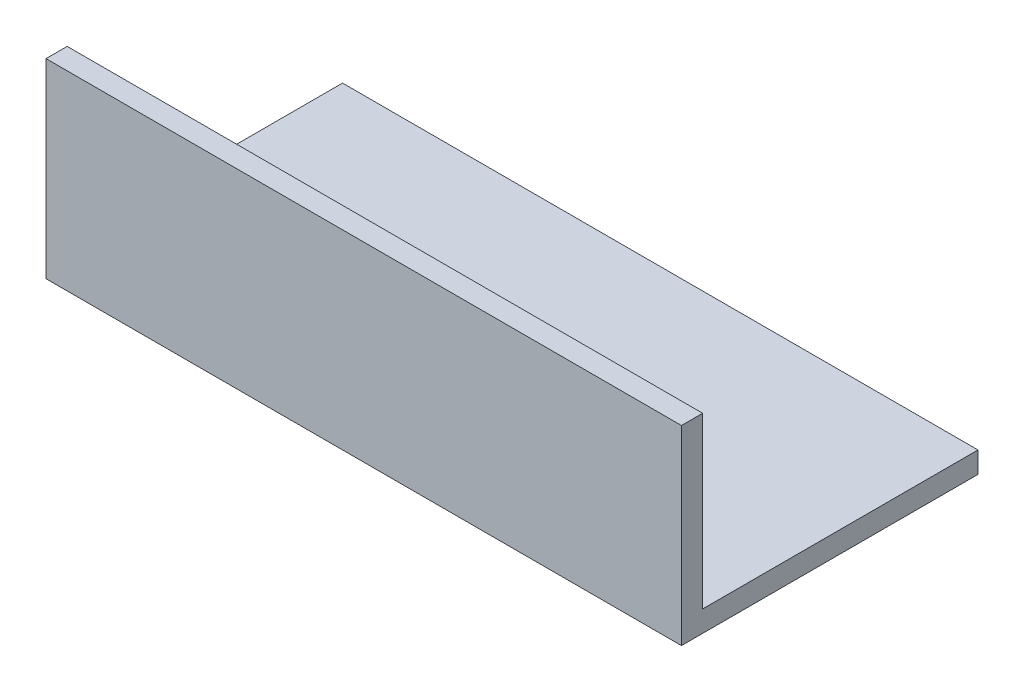
from build123d import *

# Parameters (mm, degrees)
SKETCH_1_W      = 150
SKETCH_1_H      = 40
EXTRUDE_1_DEPTH = 5
SKETCH_3_W      = 150
SKETCH_3_H      = 70
EXTRUDE_2_DEPTH = 5


with BuildPart() as part:
    # ｽｹｯﾁ1 → ﾎﾞｽ - 押し出し1 (new body)
    with BuildSketch(Plane.XY):
        Rectangle(SKETCH_1_W, SKETCH_1_H)
    extrude(amount=EXTRUDE_1_DEPTH)

    # ｽｹｯﾁ3 → ﾎﾞｽ - 押し出し2 (add)
    with BuildSketch(Plane.XZ.offset(20)):
        with Locations((0, -30)):
            Rectangle(SKETCH_3_W, SKETCH_3_H)
    extrude(amount=EXTRUDE_2_DEPTH)


solid = part.part
